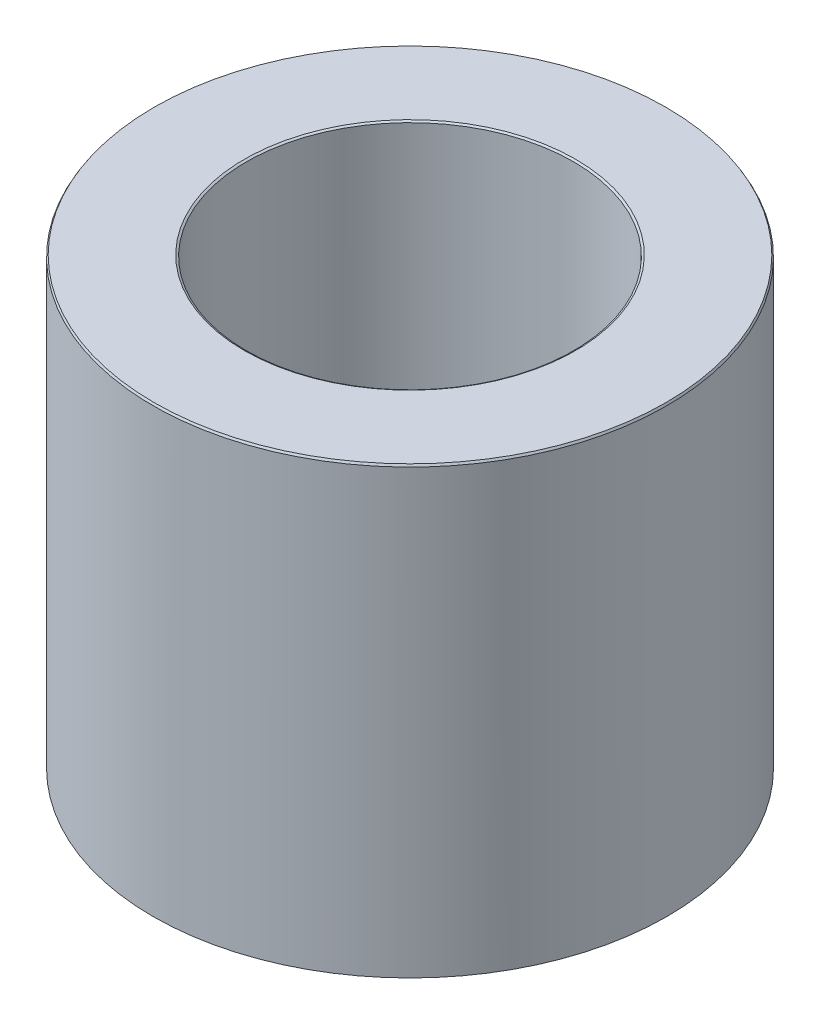
from build123d import *
from OCP.BRepFilletAPI import BRepFilletAPI_MakeChamfer

# Parameters (mm, degrees)
SKETCH1_R           = 45
BOSS_EXTRUDE1_DEPTH = 78.022029457
SKETCH2_R           = 28.653204182
CUT_EXTRUDE1_DEPTH  = 101.684840371
CHAMFER1_SIZE       = 0.353196164
CHAMFER1_SIZE2      = 0.203917901


with BuildPart() as part:
    # Sketch1 → Boss-Extrude1 (new body)
    with BuildSketch(Plane(origin=(0, 0, 0), x_dir=(1, 0, 0), z_dir=(0, 1, 0))):
        Circle(SKETCH1_R)
    extrude(amount=BOSS_EXTRUDE1_DEPTH)

    # Sketch2 → Cut-Extrude1 (cut, through all)
    with BuildSketch(Plane(origin=(0, 0, 0), x_dir=(1, 0, 0), z_dir=(0, 1, 0))):
        Circle(SKETCH2_R)
    extrude(amount=CUT_EXTRUDE1_DEPTH, mode=Mode.SUBTRACT)

    # Chamfer1: one chamfer whose edges measure the first distance from different faces: ONE call of the kernel's chamfer builder (chamfer() names one face for all edges)
    chamfer1_edges_1 = [part.edges().sort_by_distance(p)[0] for p in [
        (-28.653204182, 78.022029457, 0),
    ]]
    chamfer1_side_1 = [part.faces().sort_by_distance(p)[0] for p in [
        (-43.727207794, 78.022029457, 0),
    ]]
    chamfer1_edges_2 = [part.edges().sort_by_distance(p)[0] for p in [
        (-28.653204182, 0, 0),
    ]]
    chamfer1_side_2 = [part.faces().sort_by_distance(p)[0] for p in [
        (-28.653204182, 39.011014729, 0),
    ]]
    chamfer1_edges_3 = [part.edges().sort_by_distance(p)[0] for p in [
        (-45, 0, 0),
    ]]
    chamfer1_side_3 = [part.faces().sort_by_distance(p)[0] for p in [
        (-43.727207794, 0, 0),
    ]]
    chamfer1_edges_4 = [part.edges().sort_by_distance(p)[0] for p in [
        (-45, 78.022029457, 0),
    ]]
    chamfer1_side_4 = [part.faces().sort_by_distance(p)[0] for p in [
        (-45, 39.011014729, 0),
    ]]
    chamfer1 = BRepFilletAPI_MakeChamfer(part.part.solid().wrapped)
    for e in chamfer1_edges_1:
        chamfer1.Add(CHAMFER1_SIZE, CHAMFER1_SIZE2, e.wrapped, chamfer1_side_1[0].wrapped)  # the first distance lies on this face
    for e in chamfer1_edges_2:
        chamfer1.Add(CHAMFER1_SIZE, CHAMFER1_SIZE2, e.wrapped, chamfer1_side_2[0].wrapped)  # the first distance lies on this face
    for e in chamfer1_edges_3:
        chamfer1.Add(CHAMFER1_SIZE, CHAMFER1_SIZE2, e.wrapped, chamfer1_side_3[0].wrapped)  # the first distance lies on this face
    for e in chamfer1_edges_4:
        chamfer1.Add(CHAMFER1_SIZE, CHAMFER1_SIZE2, e.wrapped, chamfer1_side_4[0].wrapped)  # the first distance lies on this face
    add(Compound.cast(chamfer1.Shape()), mode=Mode.REPLACE)


solid = part.part
